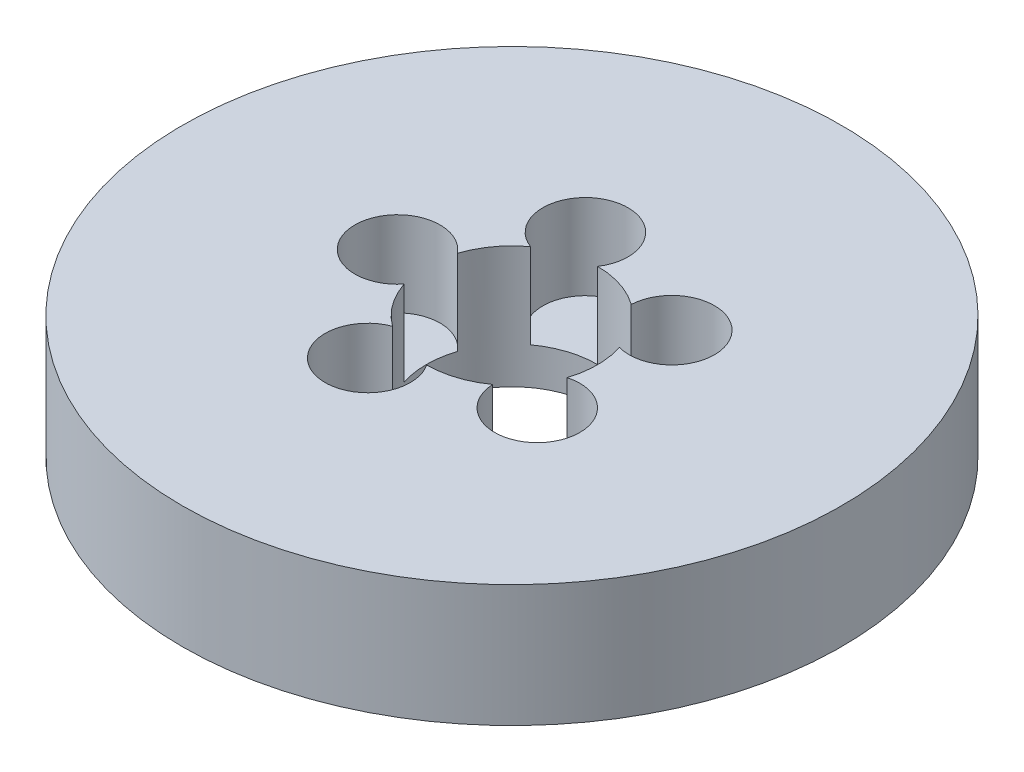
from build123d import *

# Parameters (mm, degrees)
SKETCH1_R           = 67.5
BOSS_EXTRUDE1_DEPTH = 25
SKETCH2_R           = 17.5
CUT_EXTRUDE1_DEPTH  = 99.67877178
SKETCH3_R           = 8.729452532
CUT_EXTRUDE2_DEPTH  = 17.413292251
CIRPATTERN1_COUNT   = 5


with BuildPart() as part:
    # Sketch1 → Boss-Extrude1 (new body)
    with BuildSketch(Plane(origin=(0, 0, 0), x_dir=(1, 0, 0), z_dir=(0, 1, 0))):
        Circle(SKETCH1_R)
    extrude(amount=BOSS_EXTRUDE1_DEPTH)

    # Sketch2 → Cut-Extrude1 (cut, through all)
    with BuildSketch(Plane(origin=(0, 0, 0), x_dir=(1, 0, 0), z_dir=(0, 1, 0))):
        Circle(SKETCH2_R)
    extrude(amount=CUT_EXTRUDE1_DEPTH, mode=Mode.SUBTRACT)

    # Sketch3 → Cut-Extrude2 (cut)
    with BuildSketch(Plane(origin=(0, 25, 0), x_dir=(1, 0, 0), z_dir=(0, 1, 0))):
        with Locations((-23.441506659, 0)):
            Circle(SKETCH3_R)
    cut_extrude2 = extrude(amount=-CUT_EXTRUDE2_DEPTH, mode=Mode.SUBTRACT)

    # CirPattern1: Cut-Extrude2 ×5 about axis
    cirpattern1_axis = Axis((0, 0, 0), (0, 1, 0))
    for i in range(1, CIRPATTERN1_COUNT):
        add(cut_extrude2.rotate(cirpattern1_axis, i * 360 / CIRPATTERN1_COUNT), mode=Mode.SUBTRACT)


solid = part.part
